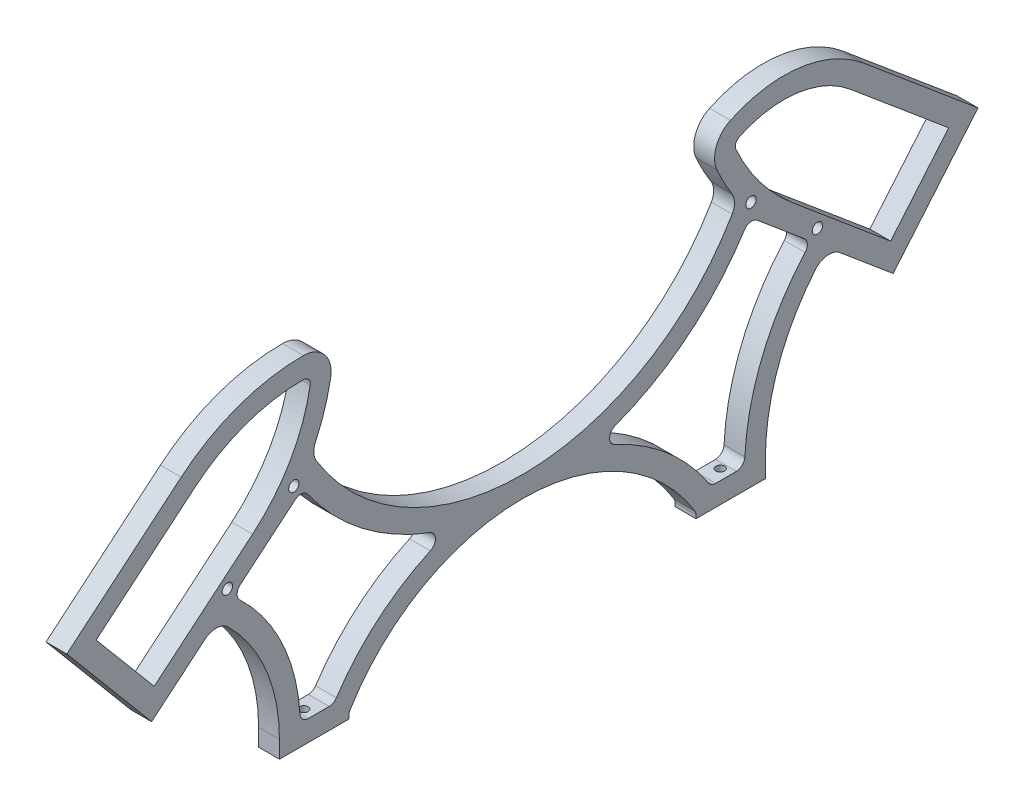
from build123d import *

# Parameters (mm, degrees)
SKETCH1_R                   = 1.5
BOSS_EXTRUDE1_DEPTH         = 6
TAP_DRILL_FOR_M3_TAP1_D     = 2.5
TAP_DRILL_FOR_M3_TAP1_DEPTH = 10
TAP_DRILL_FOR_M3_TAP1_TIP   = 0.751075774
FILLET1_R                   = 2.5


with BuildPart() as part:
    # Sketch1 → Boss-Extrude1 (new body)
    with BuildSketch(Plane(origin=(0, 0, 0), x_dir=(0, 0, -1), z_dir=(1, 0, 0))):
        with BuildLine():
            Line((0, 0), (0, 5))
            ThreePointArc((0, 5), (-3.840871797, 24.159286169), (-14.769907871, 40.357641429))
            ThreePointArc((-14.769907871, 40.357641429), (-18.081061634, 41.796853013), (-21.498126045, 40.631202964))
            Line((-21.498126045, 40.631202964), (-36.819014908, 27.77545077))
            Line((-36.819014908, 27.77545077), (-61.244944076, 56.885139609))
            Line((-61.244944076, 56.885139609), (-28.305033022, 84.525006825))
            ThreePointArc((-28.305033022, 84.525006825), (-11.818865856, 94.017171366), (6.92732781, 97.253700147))
            ThreePointArc((6.92732781, 97.253700147), (13.017620401, 94.396091574), (14.774247269, 87.902105691))
            ThreePointArc((14.774247269, 87.902105691), (13.044454009, 80.7535683), (10.36635808, 73.903635909))
            ThreePointArc((10.36635808, 73.903635909), (9.897317417, 71.491207627), (10.634326541, 69.146719003))
            ThreePointArc((10.634326541, 69.146719003), (70.997252038, 36.006591684), (130.426608884, 70.793117211))
            ThreePointArc((130.426608884, 70.793117211), (131.100196731, 73.38934155), (130.335189449, 75.960112887))
            ThreePointArc((130.335189449, 75.960112887), (128.061354254, 79.870498082), (126.059139986, 83.926675702))
            ThreePointArc((126.059139986, 83.926675702), (125.838941665, 89.977140026), (129.92035201, 94.449130124))
            ThreePointArc((129.92035201, 94.449130124), (149.83474505, 97.615635132), (168.305033022, 89.525006825))
            Line((168.305033022, 89.525006825), (201.244944076, 61.885139609))
            Line((201.244944076, 61.885139609), (176.819014908, 32.77545077))
            Line((176.819014908, 32.77545077), (161.498126045, 45.631202964))
            ThreePointArc((161.498126045, 45.631202964), (157.835218682, 46.780782607), (154.436995319, 44.99458506))
            ThreePointArc((154.436995319, 44.99458506), (143.719733916, 26.260254396), (140, 5))
            Line((140, 5), (140, 0))
            Line((140, 0), (120, 0))
            Line((120, 0), (120, 1))
            ThreePointArc((120, 1), (119.925928039, 1.539259851), (119.709198813, 2.038575668))
            ThreePointArc((119.709198813, 2.038575668), (70, 30), (20.290801187, 2.038575668))
            ThreePointArc((20.290801187, 2.038575668), (20.074071961, 1.539259851), (20, 1))
            Line((20, 1), (20, 0))
            Line((20, 0), (0, 0))
        make_face()
        with Locations((-15, 50)):
            Circle(SKETCH1_R, mode=Mode.SUBTRACT)
        with Locations((155, 55)):
            Circle(SKETCH1_R, mode=Mode.SUBTRACT)
        with Locations((4.151111078, 66.069690242)):
            Circle(SKETCH1_R, mode=Mode.SUBTRACT)
        with Locations((135.848888922, 71.069690242)):
            Circle(SKETCH1_R, mode=Mode.SUBTRACT)
        with BuildLine():
            Line((153.194197486, 52.599026355), (135.446708697, 67.490937652))
            ThreePointArc((135.446708697, 67.490937652), (116.223466855, 45.694726653), (90.211555847, 32.733695576))
            ThreePointArc((90.211555847, 32.733695576), (109.587669843, 22.332615581), (124.313902456, 6))
            Line((124.313902456, 6), (134.007287244, 6))
            ThreePointArc((134.007287244, 6), (139.167896428, 31.12471477), (153.194197486, 52.599026355))
        make_face(mode=Mode.SUBTRACT)
        with BuildLine():
            Line((6.64262448, 64.24409635), (-13.504098974, 47.338988131))
            ThreePointArc((-13.504098974, 47.338988131), (0.67831303, 28.760932732), (5.991023621, 6))
            Line((5.991023621, 6), (15.686097544, 6))
            ThreePointArc((15.686097544, 6), (30.426648893, 22.343837125), (49.822979349, 32.745146217))
            ThreePointArc((49.822979349, 32.745146217), (25.364510605, 44.562622405), (6.64262448, 64.24409635))
        make_face(mode=Mode.SUBTRACT)
        with BuildLine():
            Line((147.735829512, 65.011584646), (176.079473907, 41.228443087))
            Line((176.079473907, 41.228443087), (192.791951759, 61.145598608))
            Line((192.791951759, 61.145598608), (164.448307363, 84.928740167))
            ThreePointArc((164.448307363, 84.928740167), (149.071299974, 91.664404031), (132.492036597, 89.028204152))
            ThreePointArc((132.492036597, 89.028204152), (131.471684011, 87.910206628), (131.526733591, 86.397590547))
            ThreePointArc((131.526733591, 86.397590547), (138.428049816, 74.792622141), (147.735829512, 65.011584646))
        make_face(mode=Mode.SUBTRACT)
        with BuildLine():
            Line((-24.448307363, 79.928740167), (-52.791951759, 56.145598608))
            Line((-52.791951759, 56.145598608), (-36.079473907, 36.228443087))
            Line((-36.079473907, 36.228443087), (-7.735829512, 60.011584646))
            ThreePointArc((-7.735829512, 60.011584646), (3.128371721, 72.990356324), (8.860510459, 88.915869445))
            ThreePointArc((8.860510459, 88.915869445), (8.421353742, 90.539365916), (6.898780595, 91.253768059))
            ThreePointArc((6.898780595, 91.253768059), (-9.780163644, 88.374149721), (-24.448307363, 79.928740167))
        make_face(mode=Mode.SUBTRACT)
    extrude(amount=BOSS_EXTRUDE1_DEPTH)

    # Tap Drill for M3 Tap1
    with Locations(Plane(origin=(0, 0, 0), x_dir=(-1, 0, 0), z_dir=(0, -1, 0))):
        with Locations((-3, 10), (-3, 130)):
            Hole(TAP_DRILL_FOR_M3_TAP1_D / 2, depth=TAP_DRILL_FOR_M3_TAP1_DEPTH)
            with Locations((0, 0, -(TAP_DRILL_FOR_M3_TAP1_DEPTH + TAP_DRILL_FOR_M3_TAP1_TIP / 2))):  # 118° drill point
                Cone(0, TAP_DRILL_FOR_M3_TAP1_D / 2, TAP_DRILL_FOR_M3_TAP1_TIP, mode=Mode.SUBTRACT)

    # Fillet1
    fillet1_edges = [part.edges().sort_by_distance(p)[0] for p in [
        (3, 6, -15.686097544),
        (3, 6, -5.991023621),
        (3, 47.338988131, 13.504098974),
        (3, 64.24409635, -6.64262448),
        (3, 52.599026355, -153.194197486),
        (3, 6, -134.007287244),
        (3, 67.490937652, -135.446708697),
        (3, 32.745146217, -49.822979349),
        (3, 6, -124.313902456),
        (3, 32.733695576, -90.211555847),
    ]]
    fillet(fillet1_edges, radius=FILLET1_R)


solid = part.part
